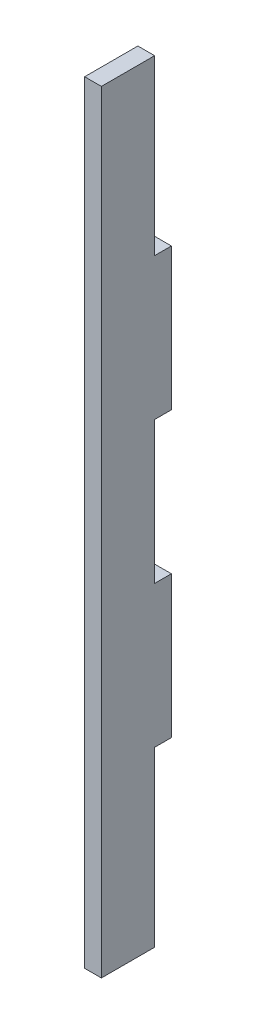
from build123d import *

# Parameters (mm, degrees)
SKETCH1_W           = 9.525
SKETCH1_H           = 5.588
BOSS_EXTRUDE1_DEPTH = 2.9972


with BuildPart() as part:
    # Sketch1 → Boss-Extrude1 (new body)
    with BuildSketch(Plane(origin=(0, 0, 0), x_dir=(0, 0, -1), z_dir=(1, 0, 0))):
        Polygon((-6.2611, 0), (-6.2611, -132.588), (3.2639, -132.588), (3.2639, -127), (3.2639, -101.6), (6.2611, -101.6), (6.2611, -76.2), (3.2639, -76.2), (3.2639, -50.8), (6.2611, -50.8), (6.2611, -25.4), (3.2639, -25.4), (3.2639, 0), align=None)
        with Locations((-1.4986, 2.794)):
            Rectangle(SKETCH1_W, SKETCH1_H)
    extrude(amount=BOSS_EXTRUDE1_DEPTH)


solid = part.part
